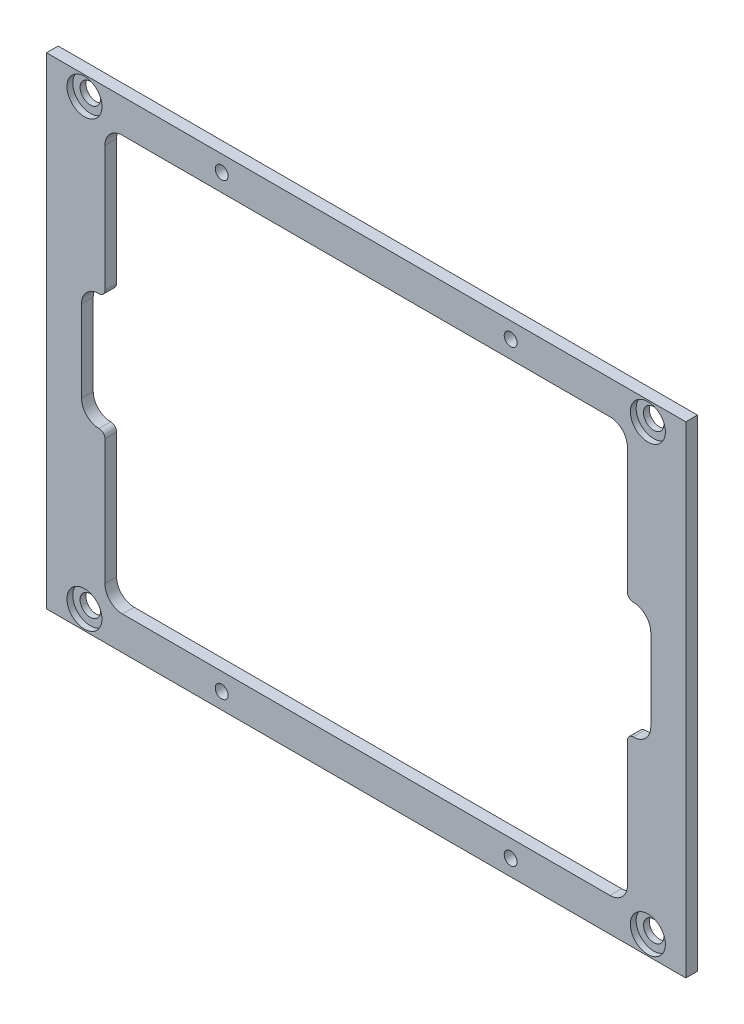
from build123d import *

# Parameters (mm, degrees)
SKETCH1_W                  = 109.5
SKETCH1_H                  = 82.5
BOSS_EXTRUDE1_DEPTH        = 2
F_3_5_3_5_DIAMETER_HOLE1_D = 3.5
F_2_2_2_2_DIAMETER_HOLE1_D = 2.2
SKETCH12_R                 = 3
CUT_EXTRUDE1_DEPTH         = 1
FILLET1_R                  = 3
FILLET2_R                  = 1


with BuildPart() as part:
    # Sketch1 → Boss-Extrude1 (new body)
    with BuildSketch(Plane.XY.offset(7.43465612)):
        with Locations((-0.743641502, 44.70185693)):
            Rectangle(SKETCH1_W, SKETCH1_H)
        with BuildLine():
            Line((-45.493641502, 34.70185693), (-49.493641502, 34.70185693))
            Line((-49.493641502, 34.70185693), (-49.493641502, 54.70185693))
            Line((-49.493641502, 54.70185693), (-45.493641502, 54.70185693))
            Line((-45.493641502, 54.70185693), (-45.493641502, 77.20185693))
            ThreePointArc((-45.493641502, 77.20185693), (-44.614961845, 79.323177274), (-42.493641502, 80.20185693))
            Line((-42.493641502, 80.20185693), (41.006358498, 80.20185693))
            ThreePointArc((41.006358498, 80.20185693), (43.127678842, 79.323177274), (44.006358498, 77.20185693))
            Line((44.006358498, 77.20185693), (44.006358498, 54.70185693))
            Line((44.006358498, 54.70185693), (48.006358498, 54.70185693))
            Line((48.006358498, 54.70185693), (48.006358498, 44.70185693))
            Line((48.006358498, 44.70185693), (48.006358498, 34.70185693))
            Line((48.006358498, 34.70185693), (44.006358498, 34.70185693))
            Line((44.006358498, 34.70185693), (44.006358498, 12.20185693))
            ThreePointArc((44.006358498, 12.20185693), (43.127678842, 10.080536587), (41.006358498, 9.20185693))
            Line((41.006358498, 9.20185693), (-42.493641502, 9.20185693))
            ThreePointArc((-42.493641502, 9.20185693), (-44.614961845, 10.080536587), (-45.493641502, 12.20185693))
            Line((-45.493641502, 12.20185693), (-45.493641502, 34.70185693))
        make_face(mode=Mode.SUBTRACT)
    extrude(amount=BOSS_EXTRUDE1_DEPTH)

    # Ø3.5 (3.5) Diameter Hole1 (through all)
    with Locations(Plane.XY.offset(9.43465612)):
        with Locations((-48.993641502, 6.70185693), (-48.993641502, 82.70185693), (47.506358498, 82.70185693), (47.506358498, 6.70185693)):
            Hole(F_3_5_3_5_DIAMETER_HOLE1_D / 2)

    # Ø2.2 (2.2) Diameter Hole1 (through all)
    with Locations(Plane(origin=(-25.493641502, 83.20185693, 9.43465612), x_dir=(1, 0, 0), z_dir=(0, 0, 1))):
        with Locations((0, 0), (49.5, 0), (49.5, -77), (0, -77)):
            Hole(F_2_2_2_2_DIAMETER_HOLE1_D / 2)

    # Sketch12 → Cut-Extrude1 (cut)
    with BuildSketch(Plane.XY.offset(9.43465612)):
        with Locations((-48.993641502, 82.70185693)):
            Circle(SKETCH12_R)
        with Locations((47.506358498, 82.70185693)):
            Circle(SKETCH12_R)
        with Locations((47.506358498, 6.70185693)):
            Circle(SKETCH12_R)
        with Locations((-48.993641502, 6.70185693)):
            Circle(SKETCH12_R)
    extrude(amount=-CUT_EXTRUDE1_DEPTH, mode=Mode.SUBTRACT)

    # Fillet1
    fillet1_edges = [part.edges().sort_by_distance(p)[0] for p in [
        (48.006358498, 34.70185693, 8.43465612),
        (48.006358498, 54.70185693, 8.43465612),
        (-49.493641502, 54.70185693, 8.43465612),
        (-49.493641502, 34.70185693, 8.43465612),
    ]]
    fillet(fillet1_edges, radius=FILLET1_R)

    # Fillet2
    fillet2_edges = [part.edges().sort_by_distance(p)[0] for p in [
        (44.006358498, 34.70185693, 8.43465612),
        (44.006358498, 54.70185693, 8.43465612),
        (-45.493641502, 34.70185693, 8.43465612),
        (-45.493641502, 54.70185693, 8.43465612),
    ]]
    fillet(fillet2_edges, radius=FILLET2_R - 0.0001)  # a hair under: the kernel refuses the full size


solid = part.part
